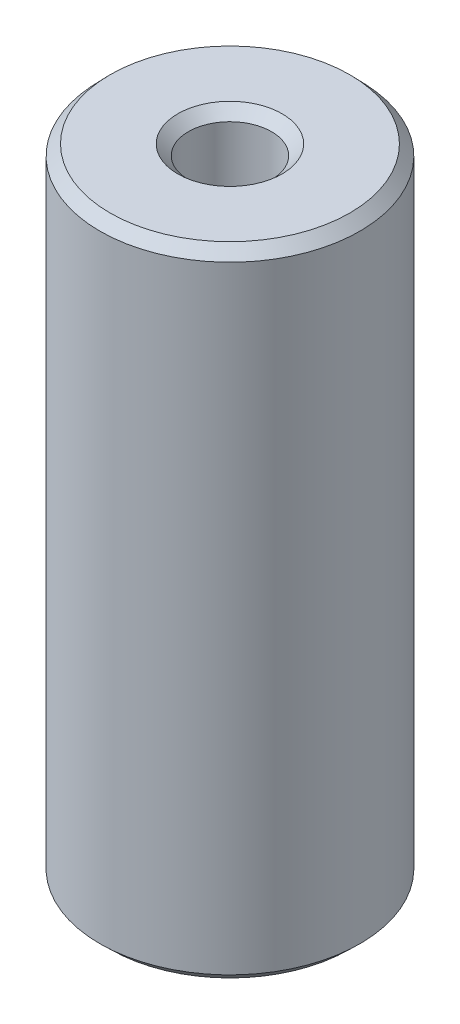
from build123d import *
from OCP.BRepFilletAPI import BRepFilletAPI_MakeChamfer

# Parameters (mm, degrees)
SKETCH1_R           = 5
BOSS_EXTRUDE1_DEPTH = 24.531407864
SKETCH2_R           = 1.5980461
CUT_EXTRUDE1_DEPTH  = 26.530177669
CHAMFER1_SIZE       = 0.407737578
CHAMFER1_SIZE2      = 0.391591973


with BuildPart() as part:
    # Sketch1 → Boss-Extrude1 (new body)
    with BuildSketch(Plane(origin=(0, 0, 0), x_dir=(1, 0, 0), z_dir=(0, 1, 0))):
        Circle(SKETCH1_R)
    extrude(amount=BOSS_EXTRUDE1_DEPTH)

    # Sketch2 → Cut-Extrude1 (cut, through all)
    with BuildSketch(Plane(origin=(0, 0, 0), x_dir=(1, 0, 0), z_dir=(0, 1, 0))):
        Circle(SKETCH2_R)
    extrude(amount=CUT_EXTRUDE1_DEPTH, mode=Mode.SUBTRACT)

    # Chamfer1: one chamfer whose edges measure the first distance from different faces: ONE call of the kernel's chamfer builder (chamfer() names one face for all edges)
    chamfer1_edges_1 = [part.edges().sort_by_distance(p)[0] for p in [
        (-1.5980461, 24.531407864, 0),
    ]]
    chamfer1_side_1 = [part.faces().sort_by_distance(p)[0] for p in [
        (-4.858578644, 24.531407864, 0),
    ]]
    chamfer1_edges_2 = [part.edges().sort_by_distance(p)[0] for p in [
        (-1.5980461, 0, 0),
    ]]
    chamfer1_side_2 = [part.faces().sort_by_distance(p)[0] for p in [
        (-1.5980461, 12.265703932, 0),
    ]]
    chamfer1_edges_3 = [part.edges().sort_by_distance(p)[0] for p in [
        (-5, 0, 0),
    ]]
    chamfer1_side_3 = [part.faces().sort_by_distance(p)[0] for p in [
        (-4.858578644, 0, 0),
    ]]
    chamfer1_edges_4 = [part.edges().sort_by_distance(p)[0] for p in [
        (-5, 24.531407864, 0),
    ]]
    chamfer1_side_4 = [part.faces().sort_by_distance(p)[0] for p in [
        (-5, 12.265703932, 0),
    ]]
    chamfer1 = BRepFilletAPI_MakeChamfer(part.part.solid().wrapped)
    for e in chamfer1_edges_1:
        chamfer1.Add(CHAMFER1_SIZE, CHAMFER1_SIZE2, e.wrapped, chamfer1_side_1[0].wrapped)  # the first distance lies on this face
    for e in chamfer1_edges_2:
        chamfer1.Add(CHAMFER1_SIZE, CHAMFER1_SIZE2, e.wrapped, chamfer1_side_2[0].wrapped)  # the first distance lies on this face
    for e in chamfer1_edges_3:
        chamfer1.Add(CHAMFER1_SIZE, CHAMFER1_SIZE2, e.wrapped, chamfer1_side_3[0].wrapped)  # the first distance lies on this face
    for e in chamfer1_edges_4:
        chamfer1.Add(CHAMFER1_SIZE, CHAMFER1_SIZE2, e.wrapped, chamfer1_side_4[0].wrapped)  # the first distance lies on this face
    add(Compound.cast(chamfer1.Shape()), mode=Mode.REPLACE)


solid = part.part
